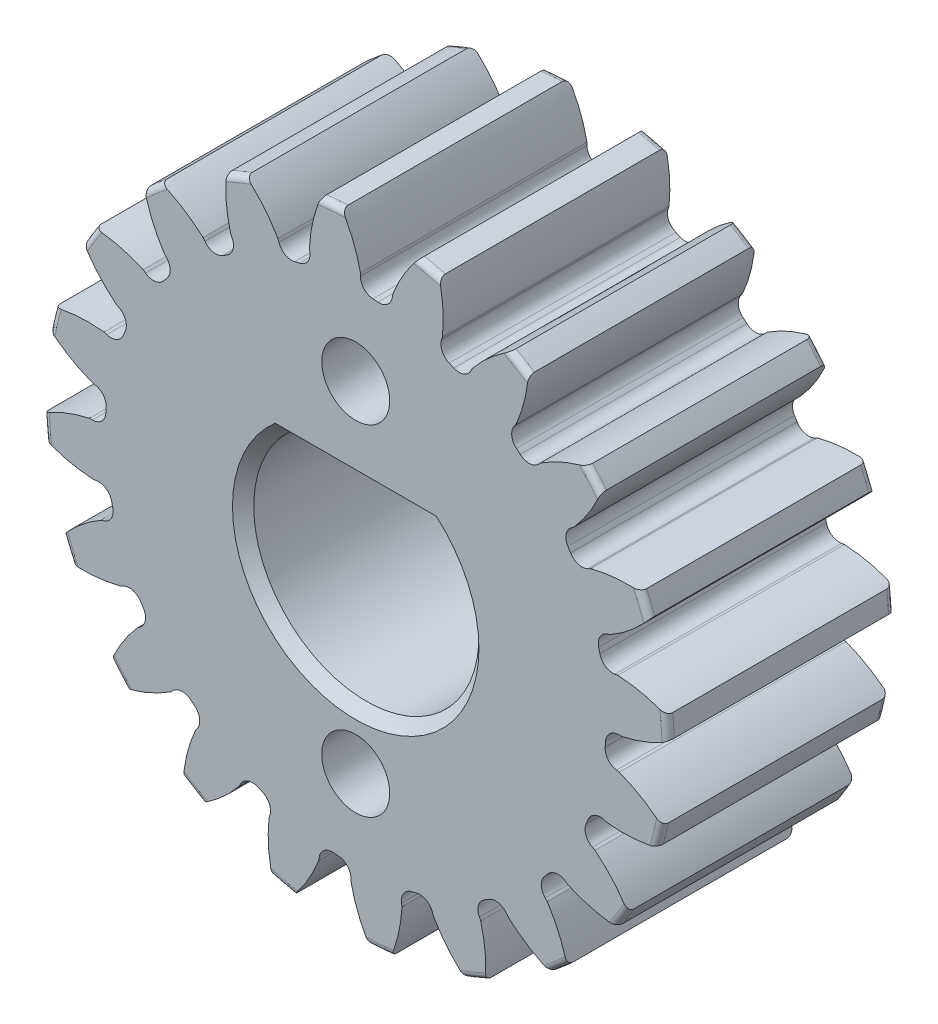
from build123d import *

# Parameters (mm, degrees)
SKETCH1_R                = 8.763
BOSS_EXTRUDE1_DEPTH      = 6.35
SKETCH2_W                = 6.3627
SKETCH2_H                = 5.953125
FILLET2_R                = 0.17526
CUT_EXTRUDE1_DEPTH       = 17.653840842
FILLET1_R                = 0.37404675
CIRPATTERN1_COUNT        = 20
FILLET1_OF_CIRPATTERN1_R = 0.37404675
CUT_EXTRUDE2_DEPTH       = 17.644788953
CHAMFER1_SIZE            = 0.29765625
SKETCH6_R                = 6.35
CUT_EXTRUDE3_DEPTH       = 4.7752
SKETCH7_R                = 0.9525
CUT_EXTRUDE5_DEPTH       = 14.91407293


with BuildPart() as part:
    # Sketch1 → Boss-Extrude1 (new body)
    with BuildSketch(Plane.XY):
        Circle(SKETCH1_R)
    extrude(amount=-BOSS_EXTRUDE1_DEPTH)

    # Sketch2 → Revolve1 (revolve)
    with BuildSketch(Plane(origin=(0, 0, 0), x_dir=(0, 0, -1), z_dir=(1, 0, 0))):
        with Locations((7.94385, 2.9765625)):
            Rectangle(SKETCH2_W, SKETCH2_H)
    revolve(axis=Axis((0, 0, -4.7625), (0, 0, -1)))

    # Fillet2
    fillet2_edges = [part.edges().sort_by_distance(p)[0] for p in [
        (-8.763, 0, -6.35),
        (-8.763, 0, 0),
        (0, -5.953125, -6.35),
    ]]
    fillet(fillet2_edges, radius=FILLET2_R)

    # Sketch4 → Cut-Extrude1 (cut, through all)
    with BuildSketch(Plane.XY):
        with BuildLine():
            Line((0.131764687, 7.457646233), (0.131764687, 7.017894383))
            ThreePointArc((0.131764687, 7.017894383), (0.550715976, 6.99749351), (0.967700662, 6.952104641))
            Line((0.967700662, 6.952104641), (1.036493167, 7.38644239))
            add(Edge.make_bspline(
                [(3.690312257, 9.886935858), (1.697229771, 9.111844986), (1.036493167, 7.38644239)],
                knots=[0, 0, 0, 1, 1, 1], degree=2))
            ThreePointArc((3.690312257, 9.886935858), (0.827995997, 10.520661949), (-2.098217069, 10.342504066))
            add(Edge.make_bspline(
                [(-2.098217069, 10.342504066), (-0.250924056, 9.265168378), (0.131764687, 7.457646233)],
                knots=[0, 0, 0, 1, 1, 1], degree=2))
        make_face()
    cut_extrude1 = extrude(amount=-CUT_EXTRUDE1_DEPTH, mode=Mode.SUBTRACT)

    # Fillet1
    fillet1_edges = [part.edges().sort_by_distance(p)[0] for p in [
        (0.967700662, 6.952104641, -3.175),
        (0.131764687, 7.017894383, -3.175),
    ]]
    fillet(fillet1_edges, radius=FILLET1_R)

    # CirPattern1: Cut-Extrude1 ×20 about axis
    cirpattern1_axis = Axis((0, 0, -6.35), (0, 0, 1))
    for i in range(1, CIRPATTERN1_COUNT):
        add(cut_extrude1.rotate(cirpattern1_axis, i * 360 / CIRPATTERN1_COUNT), mode=Mode.SUBTRACT)

    # Fillet1 of CirPattern1
    fillet1_of_cirpattern1_edges = [part.edges().sort_by_distance(p)[0] for p in [
        (-1.22798046, 6.91088037, -3.175),
        (-2.043332965, 6.715131711, -3.175),
        (-3.303458299, 6.193170979, -3.175),
        (-4.01841495, 5.75504516, -3.175),
        (-5.055570623, 4.869230861, -3.175),
        (-5.600146481, 4.231614691, -3.175),
        (-6.31280847, 3.068656501, -3.175),
        (-6.633696656, 2.293964293, -3.175),
        (-6.952104641, 0.967700662, -3.175),
        (-7.017894383, 0.131764687, -3.175),
        (-6.91088037, -1.22798046, -3.175),
        (-6.715131711, -2.043332965, -3.175),
        (-6.193170979, -3.303458299, -3.175),
        (-5.75504516, -4.01841495, -3.175),
        (-4.869230861, -5.055570623, -3.175),
        (-4.231614691, -5.600146481, -3.175),
        (-3.068656501, -6.31280847, -3.175),
        (-2.293964293, -6.633696656, -3.175),
        (-0.967700662, -6.952104641, -3.175),
        (-0.131764687, -7.017894383, -3.175),
        (1.22798046, -6.91088037, -3.175),
        (2.043332965, -6.715131711, -3.175),
        (3.303458299, -6.193170979, -3.175),
        (4.01841495, -5.75504516, -3.175),
        (5.055570623, -4.869230861, -3.175),
        (5.600146481, -4.231614691, -3.175),
        (6.31280847, -3.068656501, -3.175),
        (6.633696656, -2.293964293, -3.175),
        (6.952104641, -0.967700662, -3.175),
        (7.017894383, -0.131764687, -3.175),
        (6.91088037, 1.22798046, -3.175),
        (6.715131711, 2.043332965, -3.175),
        (6.193170979, 3.303458299, -3.175),
        (5.75504516, 4.01841495, -3.175),
        (4.869230861, 5.055570623, -3.175),
        (4.231614691, 5.600146481, -3.175),
        (3.068656501, 6.31280847, -3.175),
        (2.293964293, 6.633696656, -3.175),
    ]]
    fillet(fillet1_of_cirpattern1_edges, radius=FILLET1_OF_CIRPATTERN1_R)

    # Sketch5 → Cut-Extrude2 (cut, through all)
    with BuildSketch(Plane.XY):
        with BuildLine():
            ThreePointArc((-2.141974636, 2.31775), (0, -3.15595), (2.141974636, 2.31775))
            Line((2.141974636, 2.31775), (-2.141974636, 2.31775))
        make_face()
    extrude(amount=-CUT_EXTRUDE2_DEPTH, mode=Mode.SUBTRACT)

    # Chamfer1
    chamfer1_edges = [part.edges().sort_by_distance(p)[0] for p in [
        (0, -5.953125, -11.1252),
        (0, -3.15595, 0),
        (0, -3.15595, -11.1252),
        (0, 2.31775, 0),
    ]]
    chamfer(chamfer1_edges, length=CHAMFER1_SIZE)

    # Sketch6 → Cut-Extrude3 (cut)
    with BuildSketch(Plane(origin=(0, 0, -11.1252), x_dir=(-1, 0, 0), z_dir=(0, 0, -1))):
        Circle(SKETCH6_R)
    extrude(amount=-CUT_EXTRUDE3_DEPTH, mode=Mode.SUBTRACT)

    # Sketch7 → Cut-Extrude5 (cut, through all)
    with BuildSketch(Plane.XY):
        with Locations((0, 4.7625)):
            Circle(SKETCH7_R)
        with Locations((0, -4.7625)):
            Circle(SKETCH7_R)
    extrude(amount=-CUT_EXTRUDE5_DEPTH, mode=Mode.SUBTRACT)


solid = part.part
